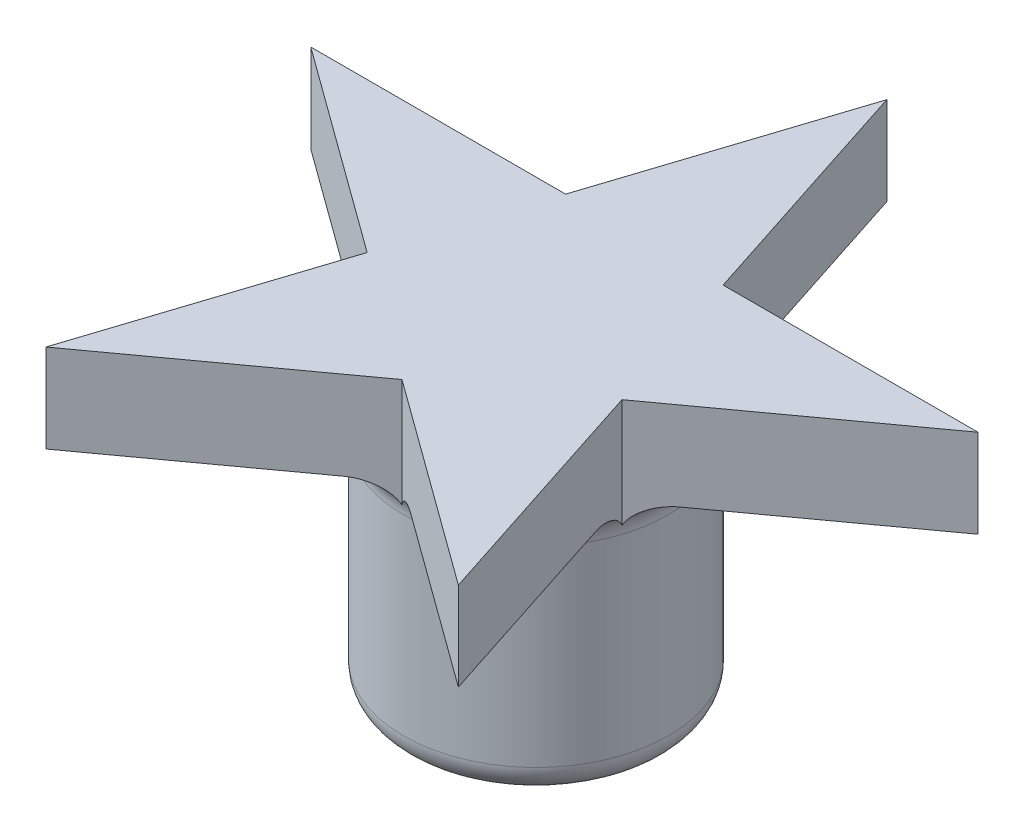
from build123d import *

# Parameters (mm, degrees)
SKETCH2_R                = 4.5
BOSS_EXTRUDE1_DEPTH      = 10
SKETCH4_R                = 1.25
CUT_EXTRUDE1_DEPTH       = 2.5
CUT_EXTRUDE4_DEPTH       = 6
BOSS_EXTRUDE7_DEPTH      = 1.5
BOSS_EXTRUDE7_DEPTH_BACK = 1.5
FILLET2_R                = 1


with BuildPart() as part:
    # Sketch2 → Boss-Extrude1 (new body)
    with BuildSketch(Plane(origin=(0, 0, 0), x_dir=(1, 0, 0), z_dir=(0, 1, 0))):
        with Locations(Location((0, 0, 0), (0, 0, 270))):
            Circle(SKETCH2_R)
    extrude(amount=BOSS_EXTRUDE1_DEPTH)

    # Sketch4 → Cut-Extrude1 (cut)
    with BuildSketch(Plane.XZ):
        with Locations(Location((0, 0, 0), (0, 0, 270))):
            Circle(SKETCH4_R)
    extrude(amount=-CUT_EXTRUDE1_DEPTH, mode=Mode.SUBTRACT)

    # Sketch5 → Cut-Extrude4 (cut)
    with BuildSketch(Plane.XZ.offset(-2.5)):
        with BuildLine():
            Line((-0.75, 1), (-0.75, -1))
            ThreePointArc((-0.75, -1), (0, -1.25), (0.75, -1))
            Line((0.75, -1), (0.75, 1))
            ThreePointArc((0.75, 1), (0, 1.25), (-0.75, 1))
        make_face()
    extrude(amount=-CUT_EXTRUDE4_DEPTH, mode=Mode.SUBTRACT)

    # Sketch3 → Boss-Extrude7 (add, two sides: drawn at the far end of the back side and taken through both)
    with BuildSketch(Plane(origin=(0, 10, 0), x_dir=(1, 0, 0), z_dir=(0, 1, 0)).offset(-BOSS_EXTRUDE7_DEPTH_BACK)):
        Polygon((0, 11.909111317), (-2.673762079, 3.680117785), (-11.326237921, 3.680117785), (-4.326237921, -1.405679911), (-7, -9.634673443), (0, -4.548875747), (7, -9.634673443), (4.326237921, -1.405679911), (11.326237921, 3.680117785), (2.673762079, 3.680117785), align=None)
    extrude(amount=BOSS_EXTRUDE7_DEPTH + BOSS_EXTRUDE7_DEPTH_BACK)

    # Fillet2
    # the kernel refuses this fillet: 1 mm, written as the material it adds along each edge
    with BuildSketch(Plane(origin=(0, 8.5, 0), x_dir=(0, 0, 1), z_dir=(1, 0, 0))) as fillet2_piece_1_section:
        with BuildLine():
            CenterArc((4.5 + FILLET2_R, FILLET2_R), FILLET2_R, 180, 90)
            Line((4.5 + FILLET2_R, 0), (4.5, 0))
            Line((4.5, 0), (4.5, FILLET2_R))
        make_face()
    fillet2_piece_1 = revolve(axis=Axis((0, 8.5, 0), (0, -1, 0)), mode=Mode.PRIVATE)
    fillet2_piece_1 = split(fillet2_piece_1, bisect_by=Plane(origin=(3e-09, 8.080053503, -3.680117785), z_dir=(0, 0, 1)), keep=Keep.TOP, mode=Mode.PRIVATE)
    fillet2_piece_1 = split(fillet2_piece_1, bisect_by=Plane(origin=(-0.015987158, 8.080053503, 4.537260397), z_dir=(0.587785252292471, 0, -0.8090169943749492)), keep=Keep.TOP, mode=Mode.PRIVATE)
    fillet2_piece_1 = split(fillet2_piece_1, bisect_by=Plane(origin=(0.015987161, 8.080053503, 4.537260395), z_dir=(-0.5877852522924681, 0, -0.8090169943749511)), keep=Keep.TOP, mode=Mode.PRIVATE)
    add(fillet2_piece_1)
    with BuildSketch(Plane(origin=(0, 8.5, 0), x_dir=(0, 0, 1), z_dir=(1, 0, 0))) as fillet2_piece_2_section:
        with BuildLine():
            CenterArc((4.5 + FILLET2_R, FILLET2_R), FILLET2_R, 180, 90)
            Line((4.5 + FILLET2_R, 0), (4.5, 0))
            Line((4.5, 0), (4.5, FILLET2_R))
        make_face()
    fillet2_piece_2 = revolve(axis=Axis((0, 8.5, 0), (0, -1, 0)), mode=Mode.PRIVATE)
    fillet2_piece_2 = split(fillet2_piece_2, bisect_by=Plane(origin=(-4.906405348, 8.214560611, 3.191251651), z_dir=(0.9510565162951518, 0, 0.30901699437495306)), keep=Keep.TOP, mode=Mode.PRIVATE)
    fillet2_piece_2 = split(fillet2_piece_2, bisect_by=Plane(origin=(4.369206305, 8.214560611, 1.537922999), z_dir=(-0.9510565162951523, 0, 0.30901699437495134)), keep=Keep.TOP, mode=Mode.PRIVATE)
    fillet2_piece_2 = split(fillet2_piece_2, bisect_by=Plane(origin=(-1.518898049, 8.214560611, 5.652419775), z_dir=(-0.5877852522924681, 0, -0.8090169943749511)), keep=Keep.TOP, mode=Mode.PRIVATE)
    add(fillet2_piece_2)
    with BuildSketch(Plane(origin=(0, 8.5, 0), x_dir=(0, 0, 1), z_dir=(1, 0, 0))) as fillet2_piece_3_section:
        with BuildLine():
            CenterArc((4.5 + FILLET2_R, FILLET2_R), FILLET2_R, 180, 90)
            Line((4.5 + FILLET2_R, 0), (4.5, 0))
            Line((4.5, 0), (4.5, FILLET2_R))
        make_face()
    fillet2_piece_3 = revolve(axis=Axis((0, 8.5, 0), (0, -1, 0)), mode=Mode.PRIVATE)
    fillet2_piece_3 = split(fillet2_piece_3, bisect_by=Plane(origin=(4.906405349, 8.214560608, 3.191251652), z_dir=(-0.9510565162951523, 0, 0.30901699437495134)), keep=Keep.TOP, mode=Mode.PRIVATE)
    fillet2_piece_3 = split(fillet2_piece_3, bisect_by=Plane(origin=(1.51889805, 8.214560608, 5.652419777), z_dir=(0.587785252292471, 0, -0.8090169943749492)), keep=Keep.TOP, mode=Mode.PRIVATE)
    fillet2_piece_3 = split(fillet2_piece_3, bisect_by=Plane(origin=(2.163118969, 8.214560608, 2.977277823), z_dir=(0.5877852522924681, 0, 0.8090169943749511)), keep=Keep.TOP, mode=Mode.PRIVATE)
    add(fillet2_piece_3)
    # the kernel refuses this fillet: 1 mm, written as the material it takes off along each edge
    with BuildSketch(Plane(origin=(0, 0, 0), x_dir=(0, 0, 1), z_dir=(-1, 0, 0))) as fillet2_2_piece_1:
        with BuildLine():
            CenterArc((4.5 - FILLET2_R, FILLET2_R), FILLET2_R, 270, 90)
            Line((4.5 - FILLET2_R, 0), (4.5, 0))
            Line((4.5, 0), (4.5, FILLET2_R))
        make_face()
    revolve(axis=Axis((0, 0, 0), (0, 1, 0)), mode=Mode.SUBTRACT)


solid = part.part
